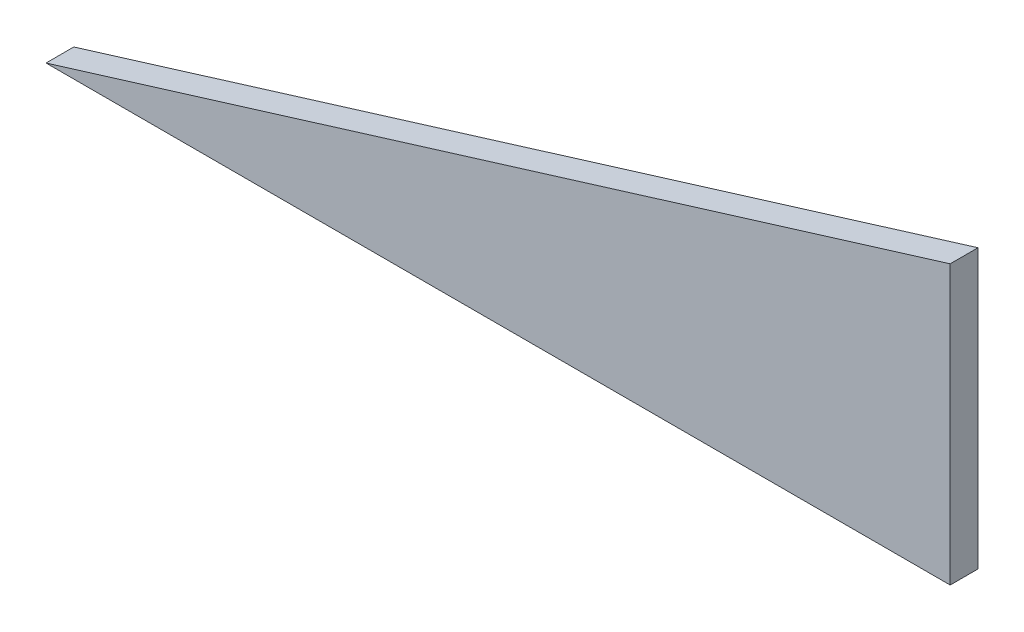
from build123d import *

# Parameters (mm, degrees)
TABAN_FLAN_1_DEPTH = 8


# Sheet-metal steps are written as plain solids
with BuildPart() as part:
    # Çizim1 → Taban-Flanş1 (new body)
    with BuildSketch(Plane.XY):
        Polygon((0, 0), (-260, 0), (0, 80), align=None)
    extrude(amount=-TABAN_FLAN_1_DEPTH)


solid = part.part
